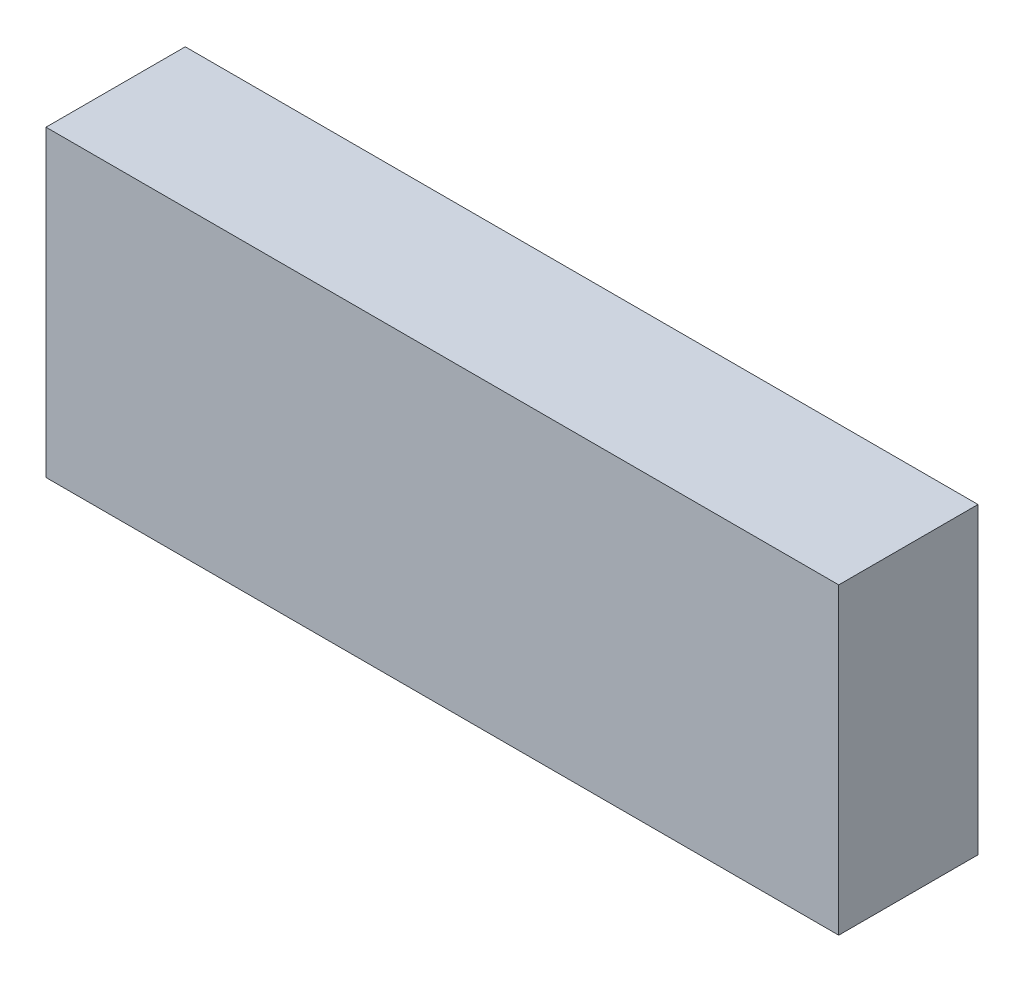
from build123d import *

# Parameters (mm, degrees)
SKETCH2_W           = 101.9
SKETCH2_H           = 17.9
BOSS_EXTRUDE1_DEPTH = 39


with BuildPart() as part:
    # Sketch2 → Boss-Extrude1 (new body)
    with BuildSketch(Plane(origin=(0, 0, 0), x_dir=(1, 0, 0), z_dir=(0, 1, 0))):
        with Locations((0.687412154, -6.236940534)):
            Rectangle(SKETCH2_W, SKETCH2_H)
    extrude(amount=BOSS_EXTRUDE1_DEPTH)


solid = part.part
